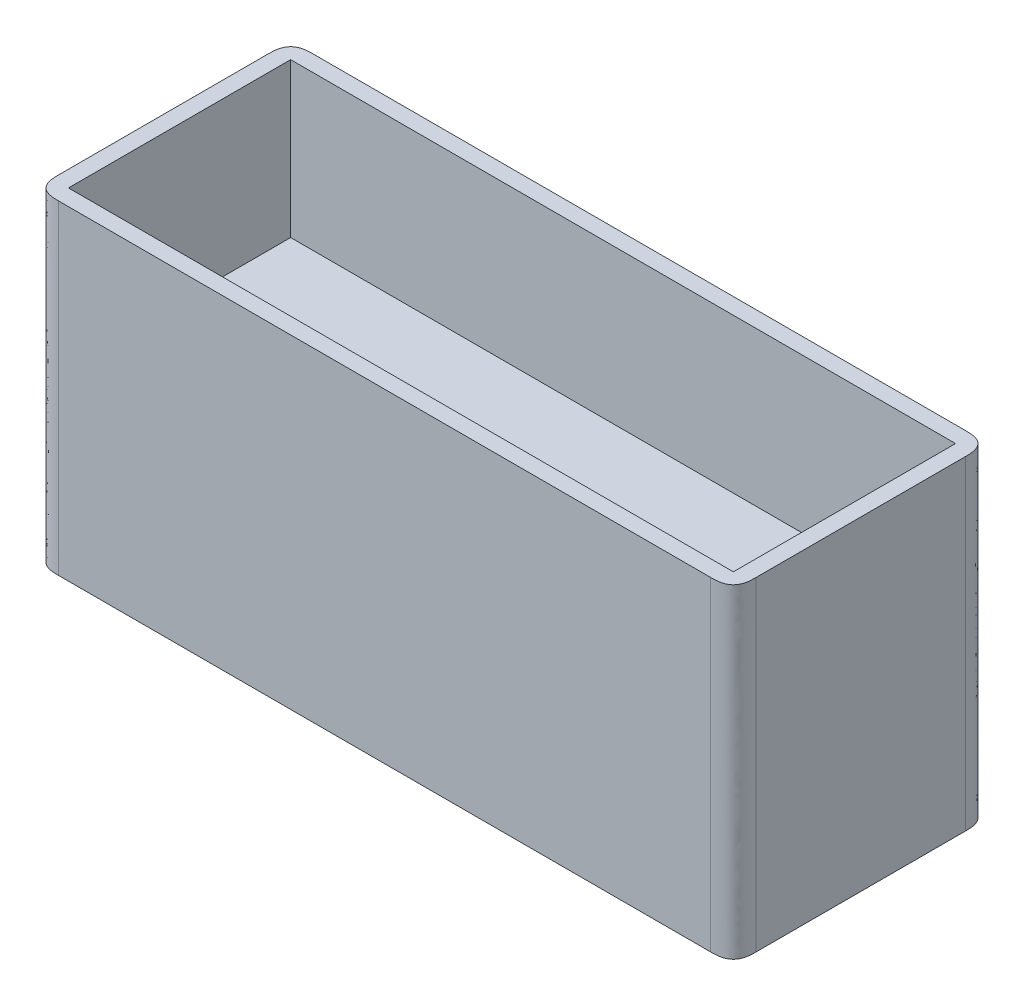
from build123d import *

# Parameters (mm, degrees)
SKETCH2_W           = 215
SKETCH2_H           = 78.5
SKETCH2_W_2         = 205
SKETCH2_H_2         = 68.5
BOSS_EXTRUDE1_DEPTH = 50
SKETCH2_2_W         = 205
SKETCH2_2_H         = 68.5
BOSS_EXTRUDE2_DEPTH = 2.5
FILLET1_SIZE        = 7


with BuildPart() as part:
    # Sketch2 → Boss-Extrude1 (new, symmetric)
    with BuildSketch(Plane(origin=(0, 0, 0), x_dir=(1, 0, 0), z_dir=(0, 1, 0))):
        Rectangle(SKETCH2_W, SKETCH2_H)
        Rectangle(SKETCH2_W_2, SKETCH2_H_2, mode=Mode.SUBTRACT)
    extrude(amount=BOSS_EXTRUDE1_DEPTH, both=True)

    # Sketch2<2> → Boss-Extrude2 (add, symmetric)
    with BuildSketch(Plane(origin=(0, 0, 0), x_dir=(1, 0, 0), z_dir=(0, 1, 0))):
        Rectangle(SKETCH2_2_W, SKETCH2_2_H)
    extrude(amount=BOSS_EXTRUDE2_DEPTH, both=True)

    # Fillet1
    # a fillet whose section is not a circle: 7 mm, written as the material it takes off along each edge
    with BuildSketch(Plane(origin=(-107.5, -67.5, -39.25), x_dir=(1, 0, 0), z_dir=(0, 1, 0)), Plane(origin=(-107.5, -67.5, 39.25), x_dir=(0, 0, -1), z_dir=(0, 1, 0)), Plane(origin=(107.5, 67.5, 39.25), x_dir=(0, 0, -1), z_dir=(0, -1, 0)), Plane(origin=(107.5, 67.5, -39.25), x_dir=(-1, 0, 0), z_dir=(0, -1, 0))) as fillet1_piece_1:
        with BuildLine():
            add(Edge.make_bspline([(FILLET1_SIZE, 0), (FILLET1_SIZE * 0.831801948466, 0), (FILLET1_SIZE * 0.663603896932, 0), (FILLET1_SIZE * 0.292893218813, -FILLET1_SIZE * 0.0716919198361), (FILLET1_SIZE * 0.0716919198361, -FILLET1_SIZE * 0.292893218813), (0, -FILLET1_SIZE * 0.663603896932), (0, -FILLET1_SIZE * 0.831801948466), (0, -FILLET1_SIZE)], knots=[0, 0, 0, 0, 0, 0, 0.5, 0.5, 1, 1, 1, 1, 1, 1], degree=5))
            Line((0, -FILLET1_SIZE), (0, 0))
            Line((0, 0), (FILLET1_SIZE, 0))
        make_face()
    extrude(amount=135, mode=Mode.SUBTRACT)


solid = part.part
